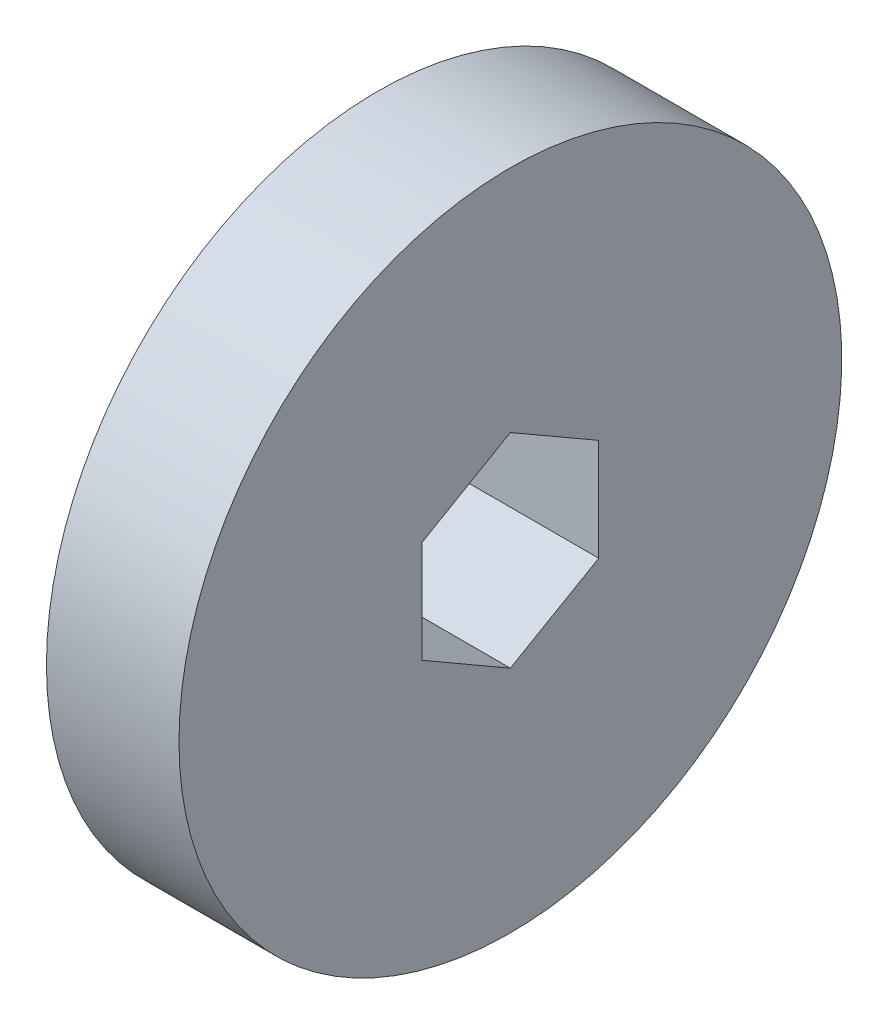
from build123d import *

# Parameters (mm, degrees)
SKETCH2_R           = 23.8125
BOSS_EXTRUDE1_DEPTH = 4.7625


with BuildPart() as part:
    # Sketch2 → Boss-Extrude1 (new, symmetric)
    with BuildSketch(Plane(origin=(0, 0, 0), x_dir=(0, 0, -1), z_dir=(1, 0, 0))):
        Circle(SKETCH2_R)
        Polygon((0, 7.332348419), (-6.35, 3.666174209), (-6.35, -3.666174209), (0, -7.332348419), (6.35, -3.666174209), (6.35, 3.666174209), align=None, mode=Mode.SUBTRACT)
    extrude(amount=BOSS_EXTRUDE1_DEPTH, both=True)


solid = part.part
